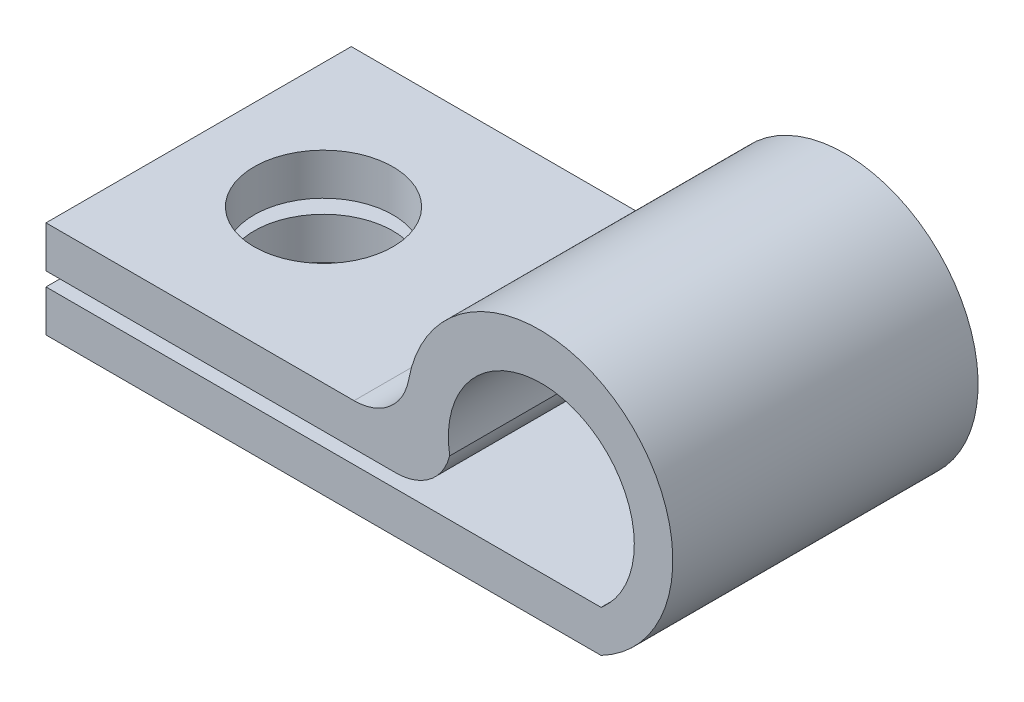
from build123d import *

# Parameters (mm, degrees)
SKETCH1_W           = 14.546192004
SKETCH1_H           = 1.5
SKETCH1_W_2         = 20
BOSS_EXTRUDE1_DEPTH = 11
SKETCH2_R           = 2.5
CUT_EXTRUDE1_DEPTH  = 25.55732176
FILLET1_R           = 2


with BuildPart() as part:
    # Sketch1 → Boss-Extrude1 (new body)
    with BuildSketch(Plane.XY):
        with Locations((-12.726903998, 2.75)):
            Rectangle(SKETCH1_W, SKETCH1_H)
        with BuildLine():
            Line((0, 1.5), (0, 0))
            ThreePointArc((0, 0), (-0.056155977, 8.546349982), (-6.953807996, 3.5))
            Line((-6.953807996, 3.5), (-5.453807996, 3.5))
            ThreePointArc((-5.453807996, 3.5), (-0.998787688, 7.212407275), (0, 1.5))
        make_face()
        with Locations((-10, 0.75)):
            Rectangle(SKETCH1_W_2, SKETCH1_H)
    extrude(amount=BOSS_EXTRUDE1_DEPTH)

    # Sketch2 → Cut-Extrude1 (cut, through all)
    with BuildSketch(Plane(origin=(0, 0, 0), x_dir=(-1, 0, 0), z_dir=(0, -1, 0))):
        with Locations(Location((15.5, -5.5, 0), (0, 0, 270))):
            Circle(SKETCH2_R)
    extrude(amount=-CUT_EXTRUDE1_DEPTH, mode=Mode.SUBTRACT)

    # Fillet1
    # the kernel refuses this fillet: 2 mm, written as the material it adds along each edge
    with BuildSketch(Plane(origin=(-6.953807996, 3.5, 0), x_dir=(-1, 0, 0), z_dir=(0, 0, 1))) as fillet1_piece_1:
        with BuildLine():
            CenterArc((1.946122673, -2), FILLET1_R, 90, 79.482966368)
            ThreePointArc((-0.0202787, -1.634944336), (0.059988825, -0.818341988), (0, 0))
            Line((0, 0), (1.946122673, 0))
        make_face()
    extrude(amount=11)
    # the kernel refuses this fillet: 2 mm, written as the material it takes off along each edge
    with BuildSketch(Plane(origin=(-5.453807996, 2, -4.841229183), x_dir=(-1, 0, 0), z_dir=(0, 0, 1))) as fillet1_2_piece_1:
        with BuildLine():
            CenterArc((1.936491673, -2), FILLET1_R, 90, 75.522487814)
            Line((0, -1.5), (0, 0))
            Line((0, 0), (1.936491673, 0))
        make_face()
    extrude(amount=20.682458366, mode=Mode.SUBTRACT)


solid = part.part
